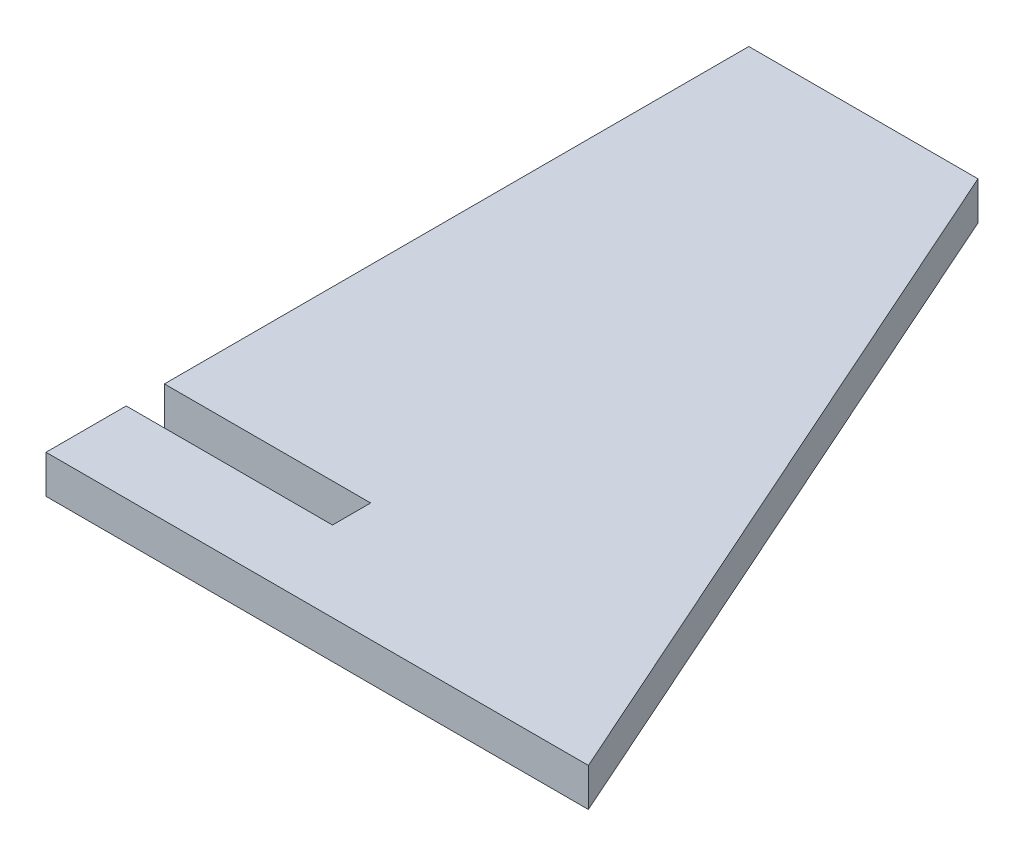
from build123d import *

# Parameters (mm, degrees)
SM_BASE_FLANGE_1_DEPTH = 5
OTHER_START            = -15
OTHER_1_OUTLINE_W      = 5
OTHER_1_OUTLINE_H      = 5
OTHER_1_DEPTH          = 27


# Read off the part's stored shape, not the designer's step: Полость1
# Sheet-metal steps are written as plain solids
with BuildPart() as part:
    # Sketch 1 → Базовая кромка1 (new body)
    with BuildSketch(Plane(origin=(0, 0, 0), x_dir=(1, 0, 0), z_dir=(0, 1, 0))):
        Polygon((-15, 0), (-15, 92), (15, 92), (56, 0), align=None)
    extrude(amount=SM_BASE_FLANGE_1_DEPTH)

    # Полость1 outline → Полость1 (cut)
    with BuildSketch(Plane.YZ.offset(OTHER_START)):
        with Locations((2.5, -13)):
            Rectangle(OTHER_1_OUTLINE_W, OTHER_1_OUTLINE_H)
    extrude(amount=OTHER_1_DEPTH, mode=Mode.SUBTRACT)


solid = part.part
